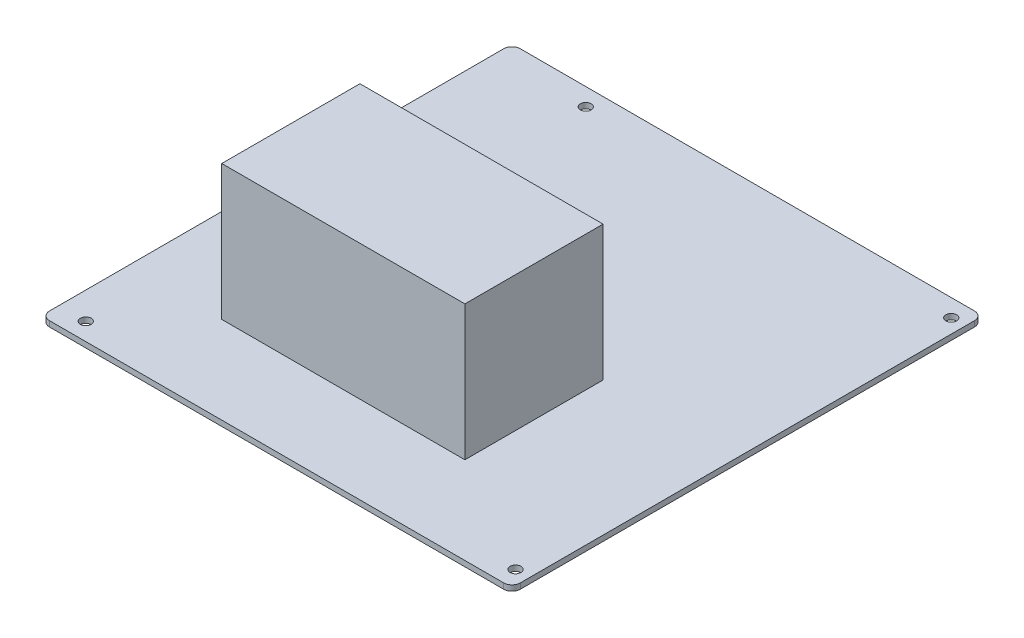
from build123d import *

# Parameters (mm, degrees)
SKETCH1_W                      = 170.18
SKETCH1_H                      = 170.18
BOSS_EXTRUDE1_DEPTH            = 2
SKETCH2_W                      = 87.877229688
SKETCH2_H                      = 49.937509255
BOSS_EXTRUDE2_DEPTH            = 48.8
FILLET1_R                      = 3
F_3_9_3_9_DIAMETER_HOLE1_D     = 3.9
F_3_9_3_9_DIAMETER_HOLE1_DEPTH = 18.75
F_3_9_3_9_DIAMETER_HOLE1_TIP   = 1.171678207


with BuildPart() as part:
    # Sketch1 → Boss-Extrude1 (new body)
    with BuildSketch(Plane(origin=(0, 0, 0), x_dir=(1, 0, 0), z_dir=(0, 1, 0))):
        Rectangle(SKETCH1_W, SKETCH1_H)
    extrude(amount=BOSS_EXTRUDE1_DEPTH)

    # Sketch2 → Boss-Extrude2 (add)
    with BuildSketch(Plane(origin=(0, 2, 0), x_dir=(1, 0, 0), z_dir=(0, 1, 0))):
        with Locations((-7.384779164, -28.607419231)):
            Rectangle(SKETCH2_W, SKETCH2_H)
    extrude(amount=BOSS_EXTRUDE2_DEPTH)

    # Fillet1
    fillet1_edges = [part.edges().sort_by_distance(p)[0] for p in [
        (-85.09, 1, -85.09),
        (85.09, 1, -85.09),
        (85.09, 1, 85.09),
        (-85.09, 1, 85.09),
    ]]
    fillet(fillet1_edges, radius=FILLET1_R)

    # Ø3.9 (3.9) Diameter Hole1
    with Locations(Plane(origin=(0, 2, 0), x_dir=(1, 0, 0), z_dir=(0, 1, 0))):
        with Locations((-75.29, -78.74), (80.01, -78.74), (80.01, 78.74), (-52.07, 78.74)):
            Hole(F_3_9_3_9_DIAMETER_HOLE1_D / 2, depth=F_3_9_3_9_DIAMETER_HOLE1_DEPTH)
            with Locations((0, 0, -(F_3_9_3_9_DIAMETER_HOLE1_DEPTH + F_3_9_3_9_DIAMETER_HOLE1_TIP / 2))):  # 118° drill point
                Cone(0, F_3_9_3_9_DIAMETER_HOLE1_D / 2, F_3_9_3_9_DIAMETER_HOLE1_TIP, mode=Mode.SUBTRACT)


solid = part.part
